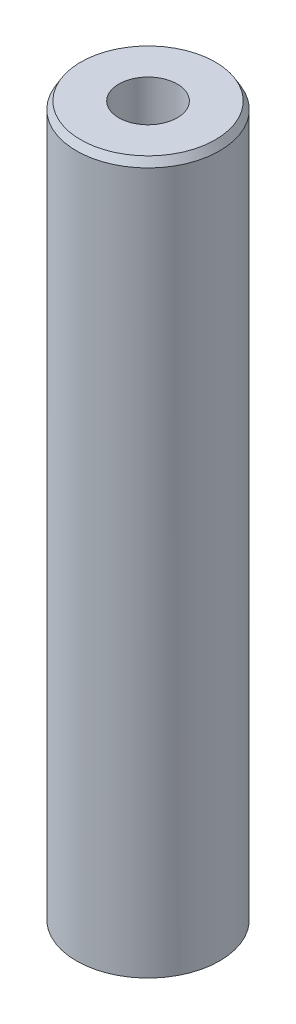
from build123d import *
from OCP.BRepFilletAPI import BRepFilletAPI_MakeChamfer

# Parameters (mm, degrees)
SKETCH1_R           = 47.5
BOSS_EXTRUDE1_DEPTH = 473.016388647
SKETCH2_R           = 19.40401095
CUT_EXTRUDE1_DEPTH  = 478.762497407
CHAMFER1_SIZE       = 4.935002315
CHAMFER1_SIZE2      = 2.849224915


with BuildPart() as part:
    # Sketch1 → Boss-Extrude1 (new body)
    with BuildSketch(Plane(origin=(0, 0, 0), x_dir=(1, 0, 0), z_dir=(0, 1, 0))):
        Circle(SKETCH1_R)
    extrude(amount=BOSS_EXTRUDE1_DEPTH)

    # Sketch2 → Cut-Extrude1 (cut, through all)
    with BuildSketch(Plane(origin=(0, 0, 0), x_dir=(1, 0, 0), z_dir=(0, 1, 0))):
        Circle(SKETCH2_R)
    extrude(amount=CUT_EXTRUDE1_DEPTH, mode=Mode.SUBTRACT)

    # Chamfer1: one chamfer whose edges measure the first distance from different faces: ONE call of the kernel's chamfer builder (chamfer() names one face for all edges)
    chamfer1_edges_1 = [part.edges().sort_by_distance(p)[0] for p in [
        (-47.5, 473.016388647, 0),
    ]]
    chamfer1_side_1 = [part.faces().sort_by_distance(p)[0] for p in [
        (-47.5, 236.508194323, 0),
    ]]
    chamfer1_edges_2 = [part.edges().sort_by_distance(p)[0] for p in [
        (-47.5, 0, 0),
    ]]
    chamfer1_side_2 = [part.faces().sort_by_distance(p)[0] for p in [
        (-46.156497116, 0, 0),
    ]]
    chamfer1 = BRepFilletAPI_MakeChamfer(part.part.solid().wrapped)
    for e in chamfer1_edges_1:
        chamfer1.Add(CHAMFER1_SIZE, CHAMFER1_SIZE2, e.wrapped, chamfer1_side_1[0].wrapped)  # the first distance lies on this face
    for e in chamfer1_edges_2:
        chamfer1.Add(CHAMFER1_SIZE, CHAMFER1_SIZE2, e.wrapped, chamfer1_side_2[0].wrapped)  # the first distance lies on this face
    add(Compound.cast(chamfer1.Shape()), mode=Mode.REPLACE)


solid = part.part
